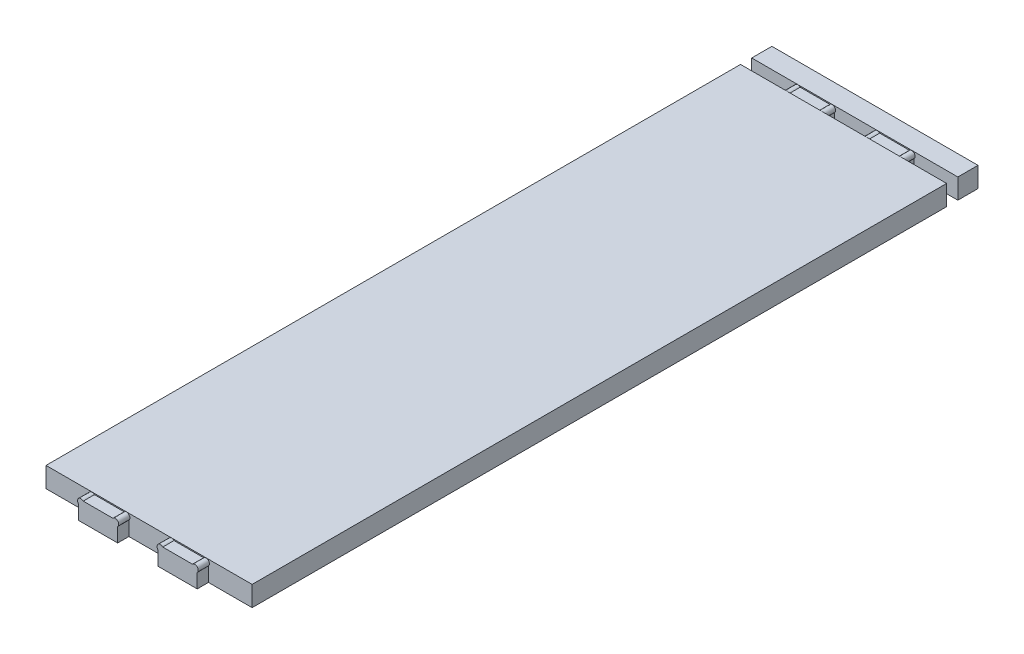
from build123d import *

# Parameters (mm, degrees)
SKETCH1_W                    = 184
SKETCH1_H                    = 18
BOSS_EXTRUDE1_DEPTH          = 658
F_3_0_3_DIAMETER_HOLE2_D     = 3
F_3_0_3_DIAMETER_HOLE2_DEPTH = 5
F_3_0_3_DIAMETER_HOLE2_TIP   = 0.901290929
CUT_EXTRUDE3_DEPTH           = 16
CAVITY1_START                = -640
CAVITY1_DEPTH                = 10
CAVITY1_START_2              = -10
CAVITY1_2_DEPTH              = 10


# Read off the part's stored shape, not the designer's step: Cavity1
with BuildPart() as part:
    # Sketch1 → Boss-Extrude1 (new body)
    with BuildSketch(Plane.XY):
        with Locations((-97.838367622, -1030.94)):
            Rectangle(SKETCH1_W, SKETCH1_H)
    extrude(amount=-BOSS_EXTRUDE1_DEPTH)

    # Ø3.0 (3) Diameter Hole2
    with Locations(Plane(origin=(0, -1039.94, 0), x_dir=(-1, 0, 0), z_dir=(0, -1, 0))):
        with Locations((97.838367622, 64), (97.838367622, 384), (97.838367622, 576), (97.838367622, 192), (97.838367622, 15.63)):
            Hole(F_3_0_3_DIAMETER_HOLE2_D / 2, depth=F_3_0_3_DIAMETER_HOLE2_DEPTH)
            with Locations((0, 0, -(F_3_0_3_DIAMETER_HOLE2_DEPTH + F_3_0_3_DIAMETER_HOLE2_TIP / 2))):  # 118° drill point
                Cone(0, F_3_0_3_DIAMETER_HOLE2_D / 2, F_3_0_3_DIAMETER_HOLE2_TIP, mode=Mode.SUBTRACT)

    # Sketch8 → Cut-Extrude3 (cut)
    with BuildSketch(Plane.XZ.offset(1039.94)):
        with BuildLine():
            Line((-108.088367622, -85.802173793), (-108.088367622, -74.197826207))
            ThreePointArc((-108.088367622, -74.197826207), (-106.088367622, -72.197826207), (-104.088367622, -74.197826207))
            Line((-104.088367622, -74.197826207), (-104.088367622, -85.802173793))
            ThreePointArc((-104.088367622, -85.802173793), (-106.088367622, -87.802173793), (-108.088367622, -85.802173793))
        make_face()
        with BuildLine():
            Line((-108.088367622, -373.121722836), (-108.088367622, -362.878277164))
            ThreePointArc((-108.088367622, -362.878277164), (-106.088367622, -360.878277164), (-104.088367622, -362.878277164))
            Line((-104.088367622, -362.878277164), (-104.088367622, -373.121722836))
            ThreePointArc((-104.088367622, -373.121722836), (-106.088367622, -375.121722836), (-108.088367622, -373.121722836))
        make_face()
        with BuildLine():
            Line((-108.088367622, -565.121722836), (-108.088367622, -554.878277164))
            ThreePointArc((-108.088367622, -554.878277164), (-106.088367622, -552.878277164), (-104.088367622, -554.878277164))
            Line((-104.088367622, -554.878277164), (-104.088367622, -565.121722836))
            ThreePointArc((-104.088367622, -565.121722836), (-106.088367622, -567.121722836), (-108.088367622, -565.121722836))
        make_face()
    extrude(amount=-CUT_EXTRUDE3_DEPTH, mode=Mode.SUBTRACT)

    # Cavity1 outline → Cavity1 (cut)
    with BuildSketch(Plane.XY.offset(CAVITY1_START)):
        with BuildLine():
            Line((-150.838367622, -1039.94), (-150.838367622, -1027.182640687))
            ThreePointArc((-150.838367622, -1027.182640687), (-150.838367621, -1022.94), (-146.595726934, -1022.94))
            Line((-146.595726934, -1022.94), (-120.081008309, -1022.94))
            ThreePointArc((-120.081008309, -1022.94), (-115.838367622, -1022.94), (-115.838367622, -1027.182640687))
            Line((-115.838367622, -1027.182640687), (-115.838367622, -1039.94))
            Line((-115.838367622, -1039.94), (-79.838367622, -1039.94))
            Line((-79.838367622, -1039.94), (-79.838367622, -1027.182640687))
            ThreePointArc((-79.838367622, -1027.182640687), (-79.838367621, -1022.94), (-75.595726934, -1022.94))
            Line((-75.595726934, -1022.94), (-49.081008309, -1022.94))
            ThreePointArc((-49.081008309, -1022.94), (-44.838367622, -1022.94), (-44.838367622, -1027.182640687))
            Line((-44.838367622, -1027.182640687), (-44.838367622, -1039.94))
            Line((-44.838367622, -1039.94), (-5.838367622, -1039.94))
            Line((-5.838367622, -1039.94), (-5.838367622, -1021.94))
            Line((-5.838367622, -1021.94), (-189.838367622, -1021.94))
            Line((-189.838367622, -1021.94), (-189.838367622, -1039.94))
            Line((-189.838367622, -1039.94), (-150.838367622, -1039.94))
        make_face()
    extrude(amount=CAVITY1_DEPTH, mode=Mode.SUBTRACT)

    # Cavity1 2 outline → Cavity1 2 (cut)
    with BuildSketch(Plane.XY.offset(CAVITY1_START_2)):
        with BuildLine():
            Line((-150.838367622, -1039.94), (-150.838367622, -1027.182640687))
            ThreePointArc((-150.838367622, -1027.182640687), (-150.838367621, -1022.94), (-146.595726934, -1022.94))
            Line((-146.595726934, -1022.94), (-120.081008309, -1022.94))
            ThreePointArc((-120.081008309, -1022.94), (-115.838367622, -1022.94), (-115.838367622, -1027.182640687))
            Line((-115.838367622, -1027.182640687), (-115.838367622, -1039.94))
            Line((-115.838367622, -1039.94), (-79.838367622, -1039.94))
            Line((-79.838367622, -1039.94), (-79.838367622, -1027.182640687))
            ThreePointArc((-79.838367622, -1027.182640687), (-79.838367621, -1022.94), (-75.595726934, -1022.94))
            Line((-75.595726934, -1022.94), (-49.081008309, -1022.94))
            ThreePointArc((-49.081008309, -1022.94), (-44.838367622, -1022.94), (-44.838367622, -1027.182640687))
            Line((-44.838367622, -1027.182640687), (-44.838367622, -1039.94))
            Line((-44.838367622, -1039.94), (-5.838367622, -1039.94))
            Line((-5.838367622, -1039.94), (-5.838367622, -1021.94))
            Line((-5.838367622, -1021.94), (-189.838367622, -1021.94))
            Line((-189.838367622, -1021.94), (-189.838367622, -1039.94))
            Line((-189.838367622, -1039.94), (-150.838367622, -1039.94))
        make_face()
    extrude(amount=CAVITY1_2_DEPTH, mode=Mode.SUBTRACT)


solid = part.part
